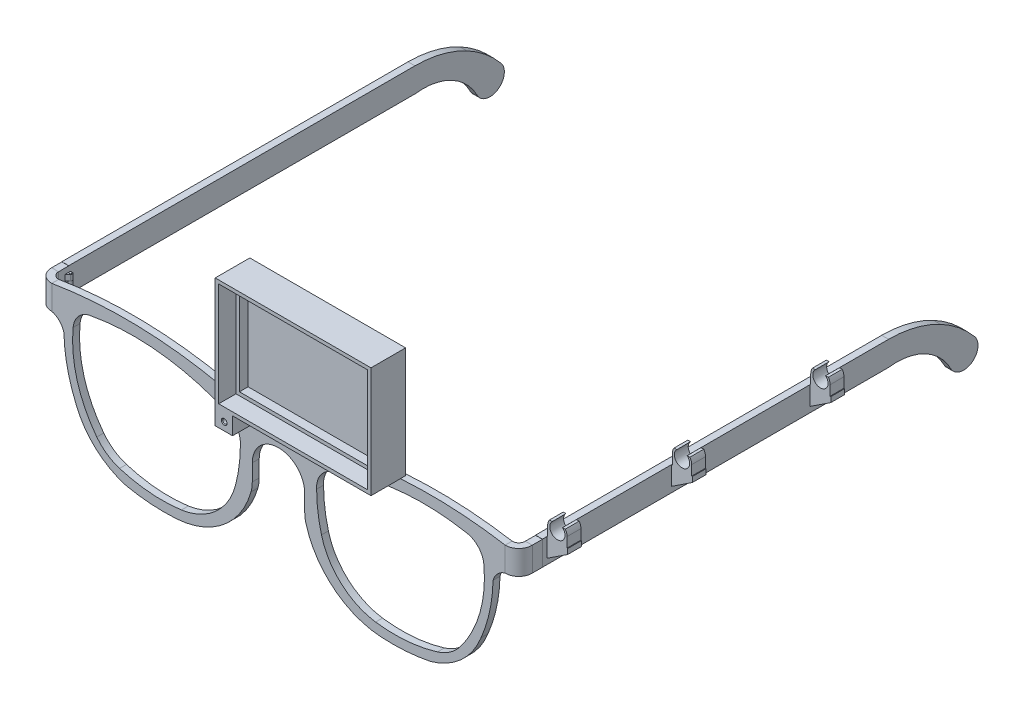
from build123d import *

# Parameters (mm, degrees)
BOSS_EXTRU_1_DEPTH              = 1
BOSS_EXTRU_1_DEPTH_BACK         = 1
ENL_V_MAT_EXTRU_1_DEPTH         = 1
ENL_V_MAT_EXTRU_1_DEPTH_BACK    = 1
BALAYAGE1_START                 = 146.132090613
BALAYAGE1_DEPTH                 = 7
ESQUISSE8_W                     = 1.997525743
ESQUISSE8_H                     = 0.789972671
ENL_V_MAT_EXTRU_2_DEPTH         = 11
ESQUISSE9_R                     = 0.25
BOSS_EXTRU_3_DEPTH              = 3.2
ESQUISSE10_W                    = 1
ESQUISSE10_H                    = 2.188025449
ENL_V_MAT_EXTRU_4_DEPTH         = 2
ESQUISSE11_W                    = 2
ESQUISSE11_H                    = 130
EXTRU_MINCE1_DEPTH              = 42
BOSS_EXTRU_5_START              = -1.5
BOSS_EXTRU_5_DEPTH              = 2.5
ESQUISSE16_W                    = 45
ESQUISSE16_H                    = 32
ESQUISSE16_W_2                  = 41
ESQUISSE16_H_2                  = 28
BOSS_EXTRU_6_DEPTH              = 7.5
ESQUISSE17_W                    = 43
ESQUISSE17_H                    = 30
ENL_V_MAT_EXTRU_5_DEPTH         = 5
ENL_V_MAT_EXTRU_6_DEPTH         = 5
ESQUISSE20_R                    = 0.25
BOSS_EXTRU_7_DEPTH              = 1.5
ESQUISSE22_W                    = 6
ESQUISSE22_H                    = 4
BOSS_EXTRU_8_DEPTH              = 1.5
BOSS_EXTRU_10_REACH             = 469.755
BOSS_EXTRU_10_DIRECTION_2_REACH = 469.755
BOSS_EXTRU_11_DEPTH             = 4
BOSS_EXTRU_12_START             = -1
ESQUISSE29_W                    = 5
ESQUISSE29_H                    = 5
BOSS_EXTRU_12_DEPTH             = 8.5
TROU_TARAUD_M1_61_D             = 1.25
TROU_TARAUD_M1_61_DEPTH         = 4.25
TROU_TARAUD_M1_61_CSINK_D       = 1.65
TROU_TARAUD_M1_61_CSINK_ANGLE   = 90
TROU_TARAUD_M1_61_TIP           = 0.375537887


# Read off the part's stored shape, not the designer's step: Balayage1, Boss.-Extru.5
with BuildPart() as part:
    # Esquisse1 → Boss.-Extru.1 (new, two sides: drawn at the far end of the back side and taken through both)
    with BuildSketch(Plane.XY.offset(-BOSS_EXTRU_1_DEPTH_BACK)):
        with BuildLine():
            Line((-275.680269958, 153.132090613), (-275.680269958, 146.132090613))
            ThreePointArc((-275.680269958, 146.132090613), (-277.912582105, 144.822314949), (-279.190933301, 142.571859877))
            ThreePointArc((-279.190933301, 142.571859877), (-280.16289209, 134.341362103), (-282.67816704, 126.444578617))
            ThreePointArc((-282.67816704, 126.444578617), (-288.379427044, 118.14671142), (-297.180269958, 113.257526452))
            ThreePointArc((-297.180269958, 113.257526452), (-304.395836718, 112.258059742), (-311.680269958, 112.238831304))
            ThreePointArc((-311.680269958, 112.238831304), (-325.23733211, 117.544097203), (-333.233691347, 129.70954086))
            ThreePointArc((-333.233691347, 129.70954086), (-333.511701277, 131.046591351), (-333.604950954, 132.409051638))
            Line((-333.604950954, 132.409051638), (-333.604950954, 137.19208022))
            ThreePointArc((-333.604950954, 137.19208022), (-341.180269958, 144.767399225), (-348.755588963, 137.19208022))
            Line((-348.755588963, 137.19208022), (-348.755588963, 132.409051638))
            ThreePointArc((-348.755588963, 132.409051638), (-348.84883864, 131.046591351), (-349.12684857, 129.70954086))
            ThreePointArc((-349.12684857, 129.70954086), (-357.123207807, 117.544097203), (-370.680269958, 112.238831304))
            ThreePointArc((-370.680269958, 112.238831304), (-377.964703199, 112.258059742), (-385.180269958, 113.257526452))
            ThreePointArc((-385.180269958, 113.257526452), (-393.981112873, 118.14671142), (-399.682372877, 126.444578617))
            ThreePointArc((-399.682372877, 126.444578617), (-402.197647827, 134.341362103), (-403.169606615, 142.571859877))
            ThreePointArc((-403.169606615, 142.571859877), (-404.447957812, 144.822314949), (-406.680269958, 146.132090613))
            Line((-406.680269958, 146.132090613), (-406.680269958, 153.132090613))
            ThreePointArc((-406.680269958, 153.132090613), (-379.041022645, 154.777257767), (-351.680269958, 150.531815566))
            ThreePointArc((-351.680269958, 150.531815566), (-346.476755525, 149.474766866), (-341.180269958, 149.099060782))
            ThreePointArc((-341.180269958, 149.099060782), (-335.883784392, 149.474766866), (-330.680269958, 150.531815566))
            ThreePointArc((-330.680269958, 150.531815566), (-303.319517272, 154.777257767), (-275.680269958, 153.132090613))
        make_face()
    extrude(amount=BOSS_EXTRU_1_DEPTH + BOSS_EXTRU_1_DEPTH_BACK)

    # Esquisse2 → Enlèv. mat.-Extru.1 (cut, two sides: drawn at the far end of the back side and taken through both)
    with BuildSketch(Plane.XY.offset(-ENL_V_MAT_EXTRU_1_DEPTH_BACK)):
        with BuildLine():
            ThreePointArc((-326.233973734, 146.276401079), (-329.214596887, 143.708052635), (-330.167425872, 139.890639239))
            ThreePointArc((-330.167425872, 139.890639239), (-329.807489047, 134.476093209), (-328.768250111, 129.150039729))
            ThreePointArc((-328.768250111, 129.150039729), (-323.059478151, 119.802211853), (-313.13916495, 115.15900722))
            ThreePointArc((-313.13916495, 115.15900722), (-304.121235334, 114.925593849), (-295.261471399, 116.623274437))
            ThreePointArc((-295.261471399, 116.623274437), (-291.619549453, 118.391836781), (-288.691576469, 121.187973836))
            ThreePointArc((-288.691576469, 121.187973836), (-282.991721591, 132.538060615), (-281.854835043, 145.187973836))
            ThreePointArc((-281.854835043, 145.187973836), (-283.373616715, 148.730321039), (-286.733973734, 150.617891482))
            ThreePointArc((-286.733973734, 150.617891482), (-306.805710005, 151.3743859), (-326.233973734, 146.276401079))
        make_face()
        with BuildLine():
            ThreePointArc((-387.099068517, 116.623274437), (-378.239304583, 114.925593849), (-369.221374967, 115.15900722))
            ThreePointArc((-369.221374967, 115.15900722), (-359.301061766, 119.802211853), (-353.592289806, 129.150039729))
            ThreePointArc((-353.592289806, 129.150039729), (-352.55305087, 134.476093209), (-352.193114045, 139.890639239))
            ThreePointArc((-352.193114045, 139.890639239), (-353.14594303, 143.708052635), (-356.126566183, 146.276401079))
            ThreePointArc((-356.126566183, 146.276401079), (-375.554829912, 151.3743859), (-395.626566183, 150.617891482))
            ThreePointArc((-395.626566183, 150.617891482), (-398.986923202, 148.730321039), (-400.505704873, 145.187973836))
            ThreePointArc((-400.505704873, 145.187973836), (-399.368818326, 132.538060615), (-393.668963448, 121.187973836))
            ThreePointArc((-393.668963448, 121.187973836), (-390.740990464, 118.391836781), (-387.099068517, 116.623274437))
        make_face()
    extrude(amount=ENL_V_MAT_EXTRU_1_DEPTH + ENL_V_MAT_EXTRU_1_DEPTH_BACK, mode=Mode.SUBTRACT)

    # Balayage1 outline → Balayage1 (add)
    with BuildSketch(Plane(origin=(0, 0, 0), x_dir=(1, 0, 0), z_dir=(0, 1, 0)).offset(BALAYAGE1_START)):
        with BuildLine():
            Line((-271.762021385, 2.926925825), (-271.762021385, 5.926925825))
            Line((-271.762021385, 5.926925825), (-273.759547128, 5.827472803))
            Line((-273.759547128, 5.827472803), (-273.759547128, 2.827472803))
            ThreePointArc((-273.759547128, 2.827472803), (-274.328043242, 1.501875481), (-275.680269958, 1))
            Line((-275.680269958, 1), (-275.680269958, -1))
            ThreePointArc((-275.680269958, -1), (-272.879094305, 0.123272211), (-271.762021385, 2.926925825))
        make_face()
    balayage1 = extrude(amount=BALAYAGE1_DEPTH)

    # Esquisse8 → Enlèv. mat.-Extru.2 (cut)
    with BuildSketch(Plane(origin=(0, 153.132090613, 0), x_dir=(1, 0, 0), z_dir=(0, 1, 0))):
        with Locations((-272.760784257, 6.222459138)):
            Rectangle(ESQUISSE8_W, ESQUISSE8_H)
    enl_v_mat_extru_2 = extrude(amount=-ENL_V_MAT_EXTRU_2_DEPTH, mode=Mode.SUBTRACT)

    # Esquisse9 → Boss.-Extru.3 (add)
    with BuildSketch(Plane(origin=(0, 153.132090613, 0), x_dir=(1, 0, 0), z_dir=(0, 1, 0))):
        with BuildLine():
            Line((-273.759547128, 4.729701714), (-274.587737792, 5.450258157))
            ThreePointArc((-274.587737792, 5.450258157), (-274.466796577, 6.282497709), (-273.759547128, 5.827472803))
            Line((-273.759547128, 5.827472803), (-273.759547128, 4.729701714))
        make_face()
        with Locations(Location((-274.259547128, 5.827472803, 0), (0, 0, 270))):
            Circle(ESQUISSE9_R, mode=Mode.SUBTRACT)
    boss_extru_3 = extrude(amount=-BOSS_EXTRU_3_DEPTH)

    # Esquisse10 → Enlèv. mat.-Extru.4 (cut, symmetric)
    with BuildSketch(Plane(origin=(0, 0, -5.827472803), x_dir=(-1, 0, 0), z_dir=(0, 0, -1))):
        with Locations((274.259547128, 152.626103338)):
            Rectangle(ESQUISSE10_W, ESQUISSE10_H)
    enl_v_mat_extru_4 = extrude(amount=ENL_V_MAT_EXTRU_4_DEPTH, both=True, mode=Mode.SUBTRACT)

    # Esquisse11 → Extru.-Mince1 (add, symmetric)
    with BuildSketch(Plane.XZ.offset(-146.132090613)):
        with Locations((-272.759547128, -70.827472803)):
            Rectangle(ESQUISSE11_W, ESQUISSE11_H)
    extru_mince1 = extrude(amount=EXTRU_MINCE1_DEPTH, both=True)

    # Boss.-Extru.5 outline → Boss.-Extru.5 (add)
    with BuildSketch(Plane.XY.offset(1).offset(BOSS_EXTRU_5_START)):
        with BuildLine():
            ThreePointArc((-330.680269958, 150.531815566), (-318.420834652, 153.175326556), (-305.963721448, 154.625235178))
            Line((-305.963721448, 154.625235178), (-305.963721448, 186.599060782))
            Line((-305.963721448, 186.599060782), (-350.963721448, 186.599060782))
            Line((-350.963721448, 186.599060782), (-350.963721448, 150.344126326))
            ThreePointArc((-350.963721448, 150.344126326), (-346.109568914, 149.426351518), (-341.180269958, 149.099060782))
            ThreePointArc((-341.180269958, 149.099060782), (-335.883784392, 149.474766866), (-330.680269958, 150.531815566))
        make_face()
    extrude(amount=BOSS_EXTRU_5_DEPTH)

    # Esquisse16 → Boss.-Extru.6 (add)
    with BuildSketch(Plane.XY.offset(2)):
        with Locations((-328.463721448, 170.599060782)):
            Rectangle(ESQUISSE16_W, ESQUISSE16_H)
        with Locations((-328.463721448, 170.599060782)):
            Rectangle(ESQUISSE16_W_2, ESQUISSE16_H_2, mode=Mode.SUBTRACT)
    extrude(amount=BOSS_EXTRU_6_DEPTH)

    # Esquisse17 → Enlèv. mat.-Extru.5 (cut)
    with BuildSketch(Plane.XY.offset(9.5)):
        with Locations((-328.463721448, 170.599060782)):
            Rectangle(ESQUISSE17_W, ESQUISSE17_H)
    extrude(amount=-ENL_V_MAT_EXTRU_5_DEPTH, mode=Mode.SUBTRACT)

    # Esquisse12 → Enlèv. mat.-Extru.6 (cut)
    with BuildSketch(Plane(origin=(-271.759547128, 0, 0), x_dir=(0, 0, -1), z_dir=(1, 0, 0))):
        with BuildLine():
            Line((5.827472803, 153.179031411), (105.827472803, 153.179031411))
            ThreePointArc((105.827472803, 153.179031411), (113.551038699, 152.229202942), (120.814333627, 149.436320725))
            ThreePointArc((120.814333627, 149.436320725), (126.142113442, 145.903842388), (130.69767953, 141.419373793))
            ThreePointArc((130.69767953, 141.419373793), (129.889361846, 135.333114301), (123.897360399, 136.671714593))
            ThreePointArc((123.897360399, 136.671714593), (116.37262602, 144.278281783), (105.834842348, 146.132090613))
            Line((105.834842348, 146.132090613), (5.827472803, 146.132090613))
            Line((5.827472803, 146.132090613), (3.197974466, 88.131245586))
            Line((3.197974466, 88.131245586), (145.092898909, 88.131245586))
            Line((145.092898909, 88.131245586), (146.720473642, 205.464587695))
            Line((146.720473642, 205.464587695), (5.827472803, 205.464587695))
            Line((5.827472803, 205.464587695), (5.827472803, 153.179031411))
        make_face()
    enl_v_mat_extru_6 = extrude(amount=-ENL_V_MAT_EXTRU_6_DEPTH, mode=Mode.SUBTRACT)

    # Esquisse20 → Boss.-Extru.7 (add)
    with BuildSketch(Plane(origin=(0, 149.932090613, 0), x_dir=(1, 0, 0), z_dir=(0, 1, 0))):
        with BuildLine():
            Line((-274.600180148, 6.19502362), (-273.758423933, 6.97513333))
            Line((-273.758423933, 6.97513333), (-273.758423933, 5.827472803))
            ThreePointArc((-273.758423933, 5.827472803), (-274.460078111, 5.368221474), (-274.600180148, 6.19502362))
        make_face()
        with Locations(Location((-274.259547128, 5.827472803, 0), (0, 0, 270))):
            Circle(ESQUISSE20_R, mode=Mode.SUBTRACT)
    boss_extru_7 = extrude(amount=-BOSS_EXTRU_7_DEPTH)

    # Esquisse21 → Révolution1 (revolve)
    with BuildSketch(Plane.ZY.offset(274.259547128)):
        with BuildLine():
            Line((-5.827472803, 151.599742773), (-5.827472803, 148.279909661))
            Line((-5.827472803, 148.279909661), (-5.52453189, 148.279909661))
            Line((-5.52453189, 148.279909661), (-5.52453189, 151.599742773))
            ThreePointArc((-5.52453189, 151.599742773), (-5.604849855, 151.8342612), (-5.827472803, 151.943297392))
            Line((-5.827472803, 151.943297392), (-5.827472803, 151.599742773))
        make_face()
    r_volution1 = revolve(axis=Axis((-274.259547128, 153.132090613, -5.827472803), (0, -1, 0)))

    # Symétrie12: Balayage1, Enlèv. mat.-Extru.2, Boss.-Extru.3, Enlèv. mat.-Extru.4, Extru.-Mince1, Enlèv. mat.-Extru.6, Boss.-Extru.7, Révolution1 across plane
    add(balayage1.mirror(Plane.ZY.offset(341.180269958)))
    add(enl_v_mat_extru_2.mirror(Plane.ZY.offset(341.180269958)), mode=Mode.SUBTRACT)
    add(boss_extru_3.mirror(Plane.ZY.offset(341.180269958)))
    add(enl_v_mat_extru_4.mirror(Plane.ZY.offset(341.180269958)), mode=Mode.SUBTRACT)
    add(extru_mince1.mirror(Plane.ZY.offset(341.180269958)))
    add(enl_v_mat_extru_6.mirror(Plane.ZY.offset(341.180269958)), mode=Mode.SUBTRACT)
    add(boss_extru_7.mirror(Plane.ZY.offset(341.180269958)))
    add(r_volution1.mirror(Plane.ZY.offset(341.180269958)))

    # Esquisse22 → Boss.-Extru.8 (add)
    with BuildSketch(Plane(origin=(0, 153.179031411, 0), x_dir=(1, 0, 0), z_dir=(0, 1, 0))):
        with Locations((-268.759547128, 9.14437594)):
            Rectangle(ESQUISSE22_W, ESQUISSE22_H)
    boss_extru_8 = extrude(amount=-BOSS_EXTRU_8_DEPTH)

    # Boss.-Extru.10: up to this face of the body (flat: up to its plane)
    boss_extru_10_end = Plane(part.part.faces().sort_by_distance((-268.759547128, 152.429031411, -7.14437594))[0])
    # Esquisse26 → Boss.-Extru.10 (add, up to the picked face)
    with BuildSketch(Plane.XY.offset(-7.64437594), mode=Mode.PRIVATE) as boss_extru_10_sk1:
        with BuildLine():
            Line((-271.050834976, 157.665655017), (-270.259547128, 157.665655017))
            ThreePointArc((-270.259547128, 157.665655017), (-268.759547128, 153.856307323), (-267.259547128, 157.665655017))
            Line((-267.259547128, 157.665655017), (-266.468259281, 157.665655017))
            ThreePointArc((-266.468259281, 157.665655017), (-266.08975257, 156.900224981), (-265.959547128, 156.056307323))
            Line((-265.959547128, 156.056307323), (-265.959547128, 153.179031411))
            Line((-265.959547128, 153.179031411), (-271.559547128, 153.179031411))
            Line((-271.559547128, 153.179031411), (-271.559547128, 156.056307323))
            ThreePointArc((-271.559547128, 156.056307323), (-271.429341687, 156.900224981), (-271.050834976, 157.665655017))
        make_face()
    boss_extru_10_tool1 = split(extrude(boss_extru_10_sk1.sketch, amount=BOSS_EXTRU_10_REACH, mode=Mode.PRIVATE), bisect_by=boss_extru_10_end, keep=Keep.BOTH, mode=Mode.PRIVATE)
    boss_extru_10 = boss_extru_10_tool1.solids().sort_by(Axis((-270.655191, 157.593899, -7.644376), (0, 0, 1)))[0]
    add(boss_extru_10)

    # Boss.-Extru.10 direction 2: up to this face of the body (flat: up to its plane)
    boss_extru_10_direction_2_end = Plane(part.part.faces().sort_by_distance((-268.759547128, 152.429031411, -11.14437594))[0])
    # Esquisse26 → Boss.-Extru.10 direction 2 (add, up to the picked face)
    with BuildSketch(Plane.XY.offset(-7.64437594), mode=Mode.PRIVATE) as boss_extru_10_direction_2_sk1:
        with BuildLine():
            Line((-271.050834976, 157.665655017), (-270.259547128, 157.665655017))
            ThreePointArc((-270.259547128, 157.665655017), (-268.759547128, 153.856307323), (-267.259547128, 157.665655017))
            Line((-267.259547128, 157.665655017), (-266.468259281, 157.665655017))
            ThreePointArc((-266.468259281, 157.665655017), (-266.08975257, 156.900224981), (-265.959547128, 156.056307323))
            Line((-265.959547128, 156.056307323), (-265.959547128, 153.179031411))
            Line((-265.959547128, 153.179031411), (-271.559547128, 153.179031411))
            Line((-271.559547128, 153.179031411), (-271.559547128, 156.056307323))
            ThreePointArc((-271.559547128, 156.056307323), (-271.429341687, 156.900224981), (-271.050834976, 157.665655017))
        make_face()
    boss_extru_10_direction_2_tool1 = split(extrude(boss_extru_10_direction_2_sk1.sketch, amount=-BOSS_EXTRU_10_DIRECTION_2_REACH, mode=Mode.PRIVATE), bisect_by=boss_extru_10_direction_2_end, keep=Keep.BOTH, mode=Mode.PRIVATE)
    boss_extru_10_direction_2 = boss_extru_10_direction_2_tool1.solids().sort_by(Axis((-270.655191, 157.593899, -7.644376), (0, 0, -1)))[0]
    add(boss_extru_10_direction_2)

    # Esquisse28 → Boss.-Extru.11 (add)
    with BuildSketch(Plane.XY.offset(-7.14437594)):
        Polygon((-265.759547128, 151.679031411), (-271.759547128, 147.732531948), (-271.759547128, 151.679031411), align=None)
    boss_extru_11 = extrude(amount=-BOSS_EXTRU_11_DEPTH)

    # Symétrie15: Boss.-Extru.8, Boss.-Extru.10, Boss.-Extru.10 direction 2, Boss.-Extru.11 across plane
    add(boss_extru_8.mirror(Plane.XY.offset(-47.14437594)))
    add(boss_extru_10.mirror(Plane.XY.offset(-47.14437594)))
    add(boss_extru_10_direction_2.mirror(Plane.XY.offset(-47.14437594)))
    add(boss_extru_11.mirror(Plane.XY.offset(-47.14437594)))

    # Symétrie16: Boss.-Extru.8, Boss.-Extru.10, Boss.-Extru.10 direction 2, Boss.-Extru.11 across plane
    add(boss_extru_8.mirror(Plane.XY.offset(-47.14437594)))
    add(boss_extru_10.mirror(Plane.XY.offset(-47.14437594)))
    add(boss_extru_10_direction_2.mirror(Plane.XY.offset(-47.14437594)))
    add(boss_extru_11.mirror(Plane.XY.offset(-47.14437594)))

    # Symétrie17: Boss.-Extru.8, Boss.-Extru.10, Boss.-Extru.10 direction 2, Boss.-Extru.11 across plane
    add(boss_extru_8.mirror(Plane.XY.offset(-27.14437594)))
    add(boss_extru_10.mirror(Plane.XY.offset(-27.14437594)))
    add(boss_extru_10_direction_2.mirror(Plane.XY.offset(-27.14437594)))
    add(boss_extru_11.mirror(Plane.XY.offset(-27.14437594)))

    # Esquisse29 → Boss.-Extru.12 (add)
    with BuildSketch(Plane.XY.offset(2).offset(BOSS_EXTRU_12_START)):
        with Locations((-348.463721448, 152.099060782)):
            Rectangle(ESQUISSE29_W, ESQUISSE29_H)
    extrude(amount=BOSS_EXTRU_12_DEPTH)

    # Trou taraudé M1.61
    with Locations(Plane.XY.offset(9.5)):
        with Locations((-348.363721448, 151.899060782)):
            CounterSinkHole(TROU_TARAUD_M1_61_D / 2, TROU_TARAUD_M1_61_CSINK_D / 2, depth=TROU_TARAUD_M1_61_DEPTH, counter_sink_angle=TROU_TARAUD_M1_61_CSINK_ANGLE)
            with Locations((0, 0, -(TROU_TARAUD_M1_61_DEPTH + TROU_TARAUD_M1_61_TIP / 2))):  # 118° drill point
                Cone(0, TROU_TARAUD_M1_61_D / 2, TROU_TARAUD_M1_61_TIP, mode=Mode.SUBTRACT)


solid = part.part
